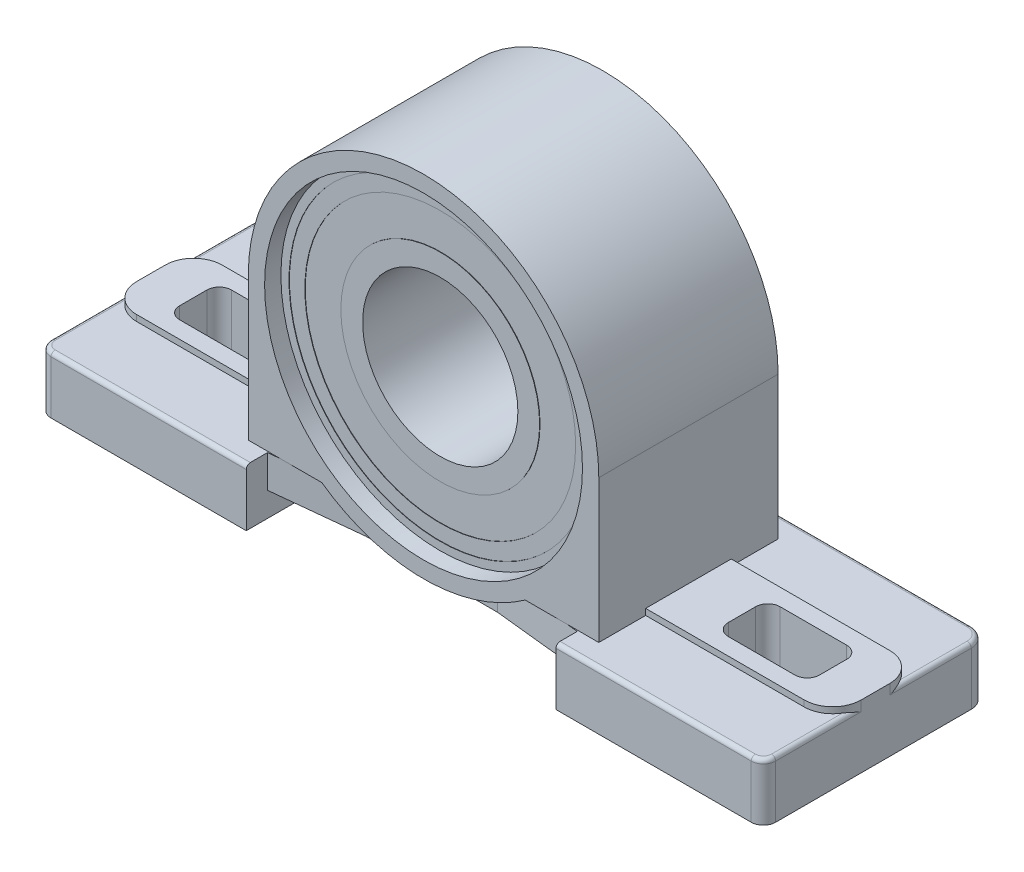
from build123d import *

# Parameters (mm, degrees)
CROQUIS1_W              = 177.8
CROQUIS1_H              = 55
SALIENTE_EXTRUIR1_DEPTH = 14
CROQUIS2_R              = 19.05
SALIENTE_EXTRUIR2_DEPTH = 55
CROQUIS3_W              = 102.441548107
CROQUIS3_H              = 5.5
CORTAR_EXTRUIR1_DEPTH   = 88
CROQUIS4_W              = 76
CROQUIS4_H              = 55
CORTAR_EXTRUIR2_DEPTH   = 6
CROQUIS5_W              = 76
CROQUIS5_H              = 5.5
CORTAR_EXTRUIR3_DEPTH   = 20
CROQUIS6_R              = 39
CORTAR_EXTRUIR4_DEPTH   = 4
CORTAR_EXTRUIR5_START   = -4
CROQUIS7_R              = 39
CORTAR_EXTRUIR5_DEPTH   = 4
CROQUIS8_R              = 37
CORTAR_EXTRUIR6_DEPTH   = 0.1
CROQUIS9_R              = 24.393304637
CROQUIS9_R_2            = 19.05
SALIENTE_EXTRUIR3_DEPTH = 12
CORTAR_EXTRUIR7_START   = -0.1
CROQUIS11_R             = 33.223696355
CROQUIS11_R_2           = 24.393304637
CORTAR_EXTRUIR7_DEPTH   = 0.1
REDONDEO1_R             = 3
CORTAR_EXTRUIR8_START   = -0.1
CROQUIS12_R             = 37
CORTAR_EXTRUIR8_DEPTH   = 0.1
CROQUIS13_R             = 33.223696355
CROQUIS13_R_2           = 24.393304637
CORTAR_EXTRUIR9_DEPTH   = 0.1
CORTAR_EXTRUIR10_DEPTH  = 2
CHAFL_N1_SIZE           = 2.3
CHAFL_N1_SIZE_2         = 21.883038245
CORTAR_EXTRUIR11_START  = -2
CORTAR_EXTRUIR11_DEPTH  = 2
CHAFL_N2_SIZE           = 2.3
CHAFL_N2_SIZE_2         = 21.883038245
REDONDEO3_R             = 4
CROQUIS17_W             = 22.352
CROQUIS17_H             = 12.7
CORTAR_EXTRUIR12_DEPTH  = 14
REDONDEO4_R             = 3
SALIENTE_EXTRUIR4_DEPTH = 1.5
REDONDEO5_R             = 1


with BuildPart() as part:
    # Croquis1 → Saliente-Extruir1 (new body)
    with BuildSketch(Plane(origin=(0, 0, 0), x_dir=(1, 0, 0), z_dir=(0, 1, 0))):
        with Locations((88.9, -27.5)):
            Rectangle(CROQUIS1_W, CROQUIS1_H)
    extrude(amount=SALIENTE_EXTRUIR1_DEPTH)

    # Croquis2 → Saliente-Extruir2 (add)
    with BuildSketch(Plane.XY.offset(55)):
        with BuildLine():
            Line((45.9, 49.022), (45.9, 13))
            Line((45.9, 13), (131.9, 13))
            Line((131.9, 13), (131.9, 49.022))
            ThreePointArc((131.9, 49.022), (88.9, 92.022), (45.9, 49.022))
        make_face()
        with Locations((88.9, 49.022)):
            Circle(CROQUIS2_R, mode=Mode.SUBTRACT)
    extrude(amount=-SALIENTE_EXTRUIR2_DEPTH)

    # Croquis3 → Cortar-Extruir1 (cut)
    with BuildSketch(Plane(origin=(0, 14, 0), x_dir=(1, 0, 0), z_dir=(0, 1, 0))):
        with Locations((84.840544714, -2.75)):
            Rectangle(CROQUIS3_W, CROQUIS3_H)
        with Locations((84.840544714, -52.25)):
            Rectangle(CROQUIS3_W, CROQUIS3_H)
    extrude(amount=CORTAR_EXTRUIR1_DEPTH, mode=Mode.SUBTRACT)

    # Croquis4 → Cortar-Extruir2 (cut)
    with BuildSketch(Plane.XZ):
        with Locations((88.9, 27.5)):
            Rectangle(CROQUIS4_W, CROQUIS4_H)
    extrude(amount=-CORTAR_EXTRUIR2_DEPTH, mode=Mode.SUBTRACT)

    # Croquis5 → Cortar-Extruir3 (cut)
    with BuildSketch(Plane.XZ.offset(-6)):
        with Locations((88.9, 2.75)):
            Rectangle(CROQUIS5_W, CROQUIS5_H)
        with Locations((88.9, 52.25)):
            Rectangle(CROQUIS5_W, CROQUIS5_H)
    extrude(amount=-CORTAR_EXTRUIR3_DEPTH, mode=Mode.SUBTRACT)

    # Croquis6 → Cortar-Extruir4 (cut)
    with BuildSketch(Plane.XY.offset(49.5)):
        with Locations((88.9, 49.022)):
            Circle(CROQUIS6_R)
    extrude(amount=-CORTAR_EXTRUIR4_DEPTH, mode=Mode.SUBTRACT)

    # Croquis7 → Cortar-Extruir5 (cut)
    with BuildSketch(Plane(origin=(0, 0, 5.5), x_dir=(-1, 0, 0), z_dir=(0, 0, -1)).offset(CORTAR_EXTRUIR5_START)):
        with Locations(Location((-88.9, 49.022, 0), (0, 0, 180))):
            Circle(CROQUIS7_R)
    extrude(amount=CORTAR_EXTRUIR5_DEPTH, mode=Mode.SUBTRACT)

    # Croquis8 → Cortar-Extruir6 (cut)
    with BuildSketch(Plane(origin=(0, 0, 9.5), x_dir=(-1, 0, 0), z_dir=(0, 0, -1))):
        with Locations((-88.9, 49.022)):
            Circle(CROQUIS8_R)
    extrude(amount=-CORTAR_EXTRUIR6_DEPTH, mode=Mode.SUBTRACT)

    # Croquis9 → Saliente-Extruir3 (add)
    with BuildSketch(Plane(origin=(0, 0, 9.6), x_dir=(-1, 0, 0), z_dir=(0, 0, -1))):
        with Locations((-88.9, 49.022)):
            Circle(CROQUIS9_R)
        with Locations(Location((-88.9, 49.022, 0), (0, 0, 180))):
            Circle(CROQUIS9_R_2, mode=Mode.SUBTRACT)
    extrude(amount=SALIENTE_EXTRUIR3_DEPTH)

    # Croquis11 → Cortar-Extruir7 (cut)
    with BuildSketch(Plane(origin=(0, 0, 9.6), x_dir=(-1, 0, 0), z_dir=(0, 0, -1)).offset(CORTAR_EXTRUIR7_START)):
        with Locations((-88.9, 49.022)):
            Circle(CROQUIS11_R)
        with Locations((-88.9, 49.022)):
            Circle(CROQUIS11_R_2, mode=Mode.SUBTRACT)
    extrude(amount=CORTAR_EXTRUIR7_DEPTH, mode=Mode.SUBTRACT)

    # Redondeo1
    redondeo1_edges = [part.edges().sort_by_distance(p)[0] for p in [
        (0, 7, 0),
        (177.8, 7, 55),
        (0, 7, 55),
    ]]
    fillet(redondeo1_edges, radius=REDONDEO1_R)

    # Croquis12 → Cortar-Extruir8 (cut)
    with BuildSketch(Plane.XY.offset(45.5).offset(CORTAR_EXTRUIR8_START)):
        with Locations(Location((88.9, 49.022, 0), (0, 0, 180))):
            Circle(CROQUIS12_R)
    extrude(amount=CORTAR_EXTRUIR8_DEPTH, mode=Mode.SUBTRACT)

    # Croquis13 → Cortar-Extruir9 (cut)
    with BuildSketch(Plane.XY.offset(45.4)):
        with Locations(Location((88.9, 49.022, 0), (0, 0, 180))):
            Circle(CROQUIS13_R)
        with Locations(Location((88.9, 49.022, 0), (0, 0, 180))):
            Circle(CROQUIS13_R_2, mode=Mode.SUBTRACT)
    extrude(amount=-CORTAR_EXTRUIR9_DEPTH, mode=Mode.SUBTRACT)

    # Croquis15 → Cortar-Extruir10 (cut)
    with BuildSketch(Plane.XY.offset(49.5)):
        with BuildLine():
            Line((50.9, 14), (63.950861418, 14))
            ThreePointArc((63.950861418, 14), (88.9, 6.022), (113.849138582, 14))
            Line((113.849138582, 14), (126.9, 14))
            Line((126.9, 14), (126.9, 6))
            Line((126.9, 6), (50.9, 6))
            Line((50.9, 6), (50.9, 14))
        make_face()
    extrude(amount=-CORTAR_EXTRUIR10_DEPTH, mode=Mode.SUBTRACT)

    # Chaflán1
    # the kernel refuses this chamfer: 21.883038245, 2.3 mm, written as the material it adds along each edge
    with BuildSketch(Plane(origin=(126.9, 14, 47.5), x_dir=(0.3420524322258251, 0, 0.9396808679591159), z_dir=(0, -1, 0))) as chafl_n1_piece_1_section:
        Polygon((CHAFL_N1_SIZE * 0.939680867959, CHAFL_N1_SIZE * 0.342052432226), (-CHAFL_N1_SIZE_2 * 0.342052432221, CHAFL_N1_SIZE_2 * 0.939680867947), (0, 0), align=None)
    chafl_n1_piece_1 = extrude(amount=8, mode=Mode.PRIVATE)
    chafl_n1_piece_1 = chafl_n1_piece_1 - Plane(origin=(88.9, 49.022, 49.6), x_dir=(1, 0, 0), z_dir=(0, 0, 1)) * Cylinder(43, 99, mode=Mode.PRIVATE)
    add(chafl_n1_piece_1)
    with BuildSketch(Plane(origin=(50.9, 6, 47.5), x_dir=(0.999991915182878, 0, -0.00402114024619802), z_dir=(0, 1, 0))) as chafl_n1_piece_2_section:
        Polygon((CHAFL_N1_SIZE_2 * 0.99999191517, -CHAFL_N1_SIZE_2 * 0.00402114024615), (-CHAFL_N1_SIZE * 0.0040211402462, -CHAFL_N1_SIZE * 0.999991915183), (0, 0), align=None)
    chafl_n1_piece_2 = extrude(amount=8, mode=Mode.PRIVATE)
    chafl_n1_piece_2 = chafl_n1_piece_2 - Plane(origin=(88.9, 49.022, 48.263647877), x_dir=(1, 0, 0), z_dir=(0, 0, 1)) * Cylinder(43, 104, mode=Mode.PRIVATE)
    add(chafl_n1_piece_2)

    # Croquis16 → Cortar-Extruir11 (cut)
    with BuildSketch(Plane(origin=(0, 0, 5.5), x_dir=(-1, 0, 0), z_dir=(0, 0, -1)).offset(CORTAR_EXTRUIR11_START)):
        with BuildLine():
            Line((-126.9, 14), (-113.849138582, 14))
            ThreePointArc((-113.849138582, 14), (-88.9, 6.022), (-63.950861418, 14))
            Line((-63.950861418, 14), (-50.9, 14))
            Line((-50.9, 14), (-50.9, 6))
            Line((-50.9, 6), (-126.9, 6))
            Line((-126.9, 6), (-126.9, 14))
        make_face()
    extrude(amount=CORTAR_EXTRUIR11_DEPTH, mode=Mode.SUBTRACT)

    # Chaflán2
    # the kernel refuses this chamfer: 21.883038245, 2.3 mm, written as the material it adds along each edge
    with BuildSketch(Plane(origin=(50.9, 14, 7.5), x_dir=(-0.3420524322258248, 0, -0.939680867959116), z_dir=(0, -1, 0))) as chafl_n2_piece_1_section:
        Polygon((CHAFL_N2_SIZE * 0.939680867959, CHAFL_N2_SIZE * 0.342052432226), (-CHAFL_N2_SIZE_2 * 0.342052432221, CHAFL_N2_SIZE_2 * 0.939680867947), (0, 0), align=None)
    chafl_n2_piece_1 = extrude(amount=8, mode=Mode.PRIVATE)
    chafl_n2_piece_1 = chafl_n2_piece_1 - Plane(origin=(88.9, 49.022, 5.4), x_dir=(1, 0, 0), z_dir=(0, 0, 1)) * Cylinder(39, 99, mode=Mode.PRIVATE)
    add(chafl_n2_piece_1)
    with BuildSketch(Plane(origin=(126.9, 6, 7.5), x_dir=(0.3420524322258251, 0, -0.9396808679591159), z_dir=(0, 1, 0))) as chafl_n2_piece_2_section:
        Polygon((CHAFL_N2_SIZE * 0.939680867959, CHAFL_N2_SIZE * 0.342052432226), (-CHAFL_N2_SIZE_2 * 0.342052432221, CHAFL_N2_SIZE_2 * 0.939680867947), (0, 0), align=None)
    chafl_n2_piece_2 = extrude(amount=8, mode=Mode.PRIVATE)
    chafl_n2_piece_2 = chafl_n2_piece_2 - Plane(origin=(88.9, 49.022, 5.4), x_dir=(1, 0, 0), z_dir=(0, 0, 1)) * Cylinder(39, 99, mode=Mode.PRIVATE)
    add(chafl_n2_piece_2)

    # Redondeo3
    redondeo3_edges = [part.edges().sort_by_distance(p)[0] for p in [
        (177.8, 7, 0),
    ]]
    fillet(redondeo3_edges, radius=REDONDEO3_R)

    # Croquis17 → Cortar-Extruir12 (cut)
    with BuildSketch(Plane(origin=(0, 14, 0), x_dir=(1, 0, 0), z_dir=(0, 1, 0))):
        with Locations((156.21, -27.5)):
            Rectangle(CROQUIS17_W, CROQUIS17_H)
        with Locations((21.59, -27.5)):
            Rectangle(CROQUIS17_W, CROQUIS17_H)
    extrude(amount=-CORTAR_EXTRUIR12_DEPTH, mode=Mode.SUBTRACT)

    # Redondeo4
    redondeo4_edges = [part.edges().sort_by_distance(p)[0] for p in [
        (145.034, 7, 33.85),
        (145.034, 7, 21.15),
        (167.386, 7, 21.15),
        (167.386, 7, 33.85),
        (10.414, 7, 33.85),
        (10.414, 7, 21.15),
        (32.766, 7, 21.15),
        (32.766, 7, 33.85),
    ]]
    fillet(redondeo4_edges, radius=REDONDEO4_R)

    # Croquis18 → Saliente-Extruir4 (add)
    # profile 1 of 2: a face of its own
    with BuildSketch(Plane(origin=(0, 14, 0), x_dir=(1, 0, 0), z_dir=(0, 1, 0))):
        with BuildLine():
            Line((45.9, -38), (7, -38))
            ThreePointArc((7, -38), (2.050252532, -35.949747468), (0, -31))
            Line((0, -31), (0, -27.5))
            Line((0, -27.5), (0, -24))
            ThreePointArc((0, -24), (2.050252532, -19.050252532), (7, -17))
            Line((7, -17), (45.9, -17))
            Line((45.9, -17), (45.9, -27.5))
            Line((45.9, -27.5), (45.9, -38))
        make_face()
        with BuildLine():
            Line((29.766, -33.85), (13.414, -33.85))
            ThreePointArc((13.414, -33.85), (11.292679656, -32.971320344), (10.414, -30.85))
            Line((10.414, -30.85), (10.414, -24.15))
            ThreePointArc((10.414, -24.15), (11.292679656, -22.028679656), (13.414, -21.15))
            Line((13.414, -21.15), (29.766, -21.15))
            ThreePointArc((29.766, -21.15), (31.887320344, -22.028679656), (32.766, -24.15))
            Line((32.766, -24.15), (32.766, -30.85))
            ThreePointArc((32.766, -30.85), (31.887320344, -32.971320344), (29.766, -33.85))
        make_face(mode=Mode.SUBTRACT)
    # profile 2 of 2: a face of its own
    with BuildSketch(Plane(origin=(0, 14, 0), x_dir=(1, 0, 0), z_dir=(0, 1, 0))):
        with BuildLine():
            Line((131.9, -27.5), (131.9, -38))
            Line((131.9, -38), (170.8, -38))
            ThreePointArc((170.8, -38), (175.749747468, -35.949747468), (177.8, -31))
            Line((177.8, -31), (177.8, -27.5))
            Line((177.8, -27.5), (177.8, -24))
            ThreePointArc((177.8, -24), (175.749747468, -19.050252532), (170.8, -17))
            Line((170.8, -17), (131.9, -17))
            Line((131.9, -17), (131.9, -27.5))
        make_face()
        with BuildLine():
            Line((167.386, -24.15), (167.386, -30.85))
            ThreePointArc((167.386, -30.85), (166.507320344, -32.971320344), (164.386, -33.85))
            Line((164.386, -33.85), (148.034, -33.85))
            ThreePointArc((148.034, -33.85), (145.912679656, -32.971320344), (145.034, -30.85))
            Line((145.034, -30.85), (145.034, -24.15))
            ThreePointArc((145.034, -24.15), (145.912679656, -22.028679656), (148.034, -21.15))
            Line((148.034, -21.15), (164.386, -21.15))
            ThreePointArc((164.386, -21.15), (166.507320344, -22.028679656), (167.386, -24.15))
        make_face(mode=Mode.SUBTRACT)
    extrude(amount=SALIENTE_EXTRUIR4_DEPTH)

    # Redondeo5
    redondeo5_edges = [part.edges().sort_by_distance(p)[0] for p in [
        (177.8, 14, 41.5),
        (176.921320344, 14, 54.121320344),
        (177.8, 14, 14),
        (176.628427125, 14, 1.171572875),
        (0, 14, 41.5),
        (0.878679656, 14, 54.121320344),
        (0, 14, 13.5),
        (0.878679656, 14, 0.878679656),
        (150.85, 14, 55),
        (150.35, 14, 0),
    ]]
    fillet(redondeo5_edges, radius=REDONDEO5_R)


solid = part.part
